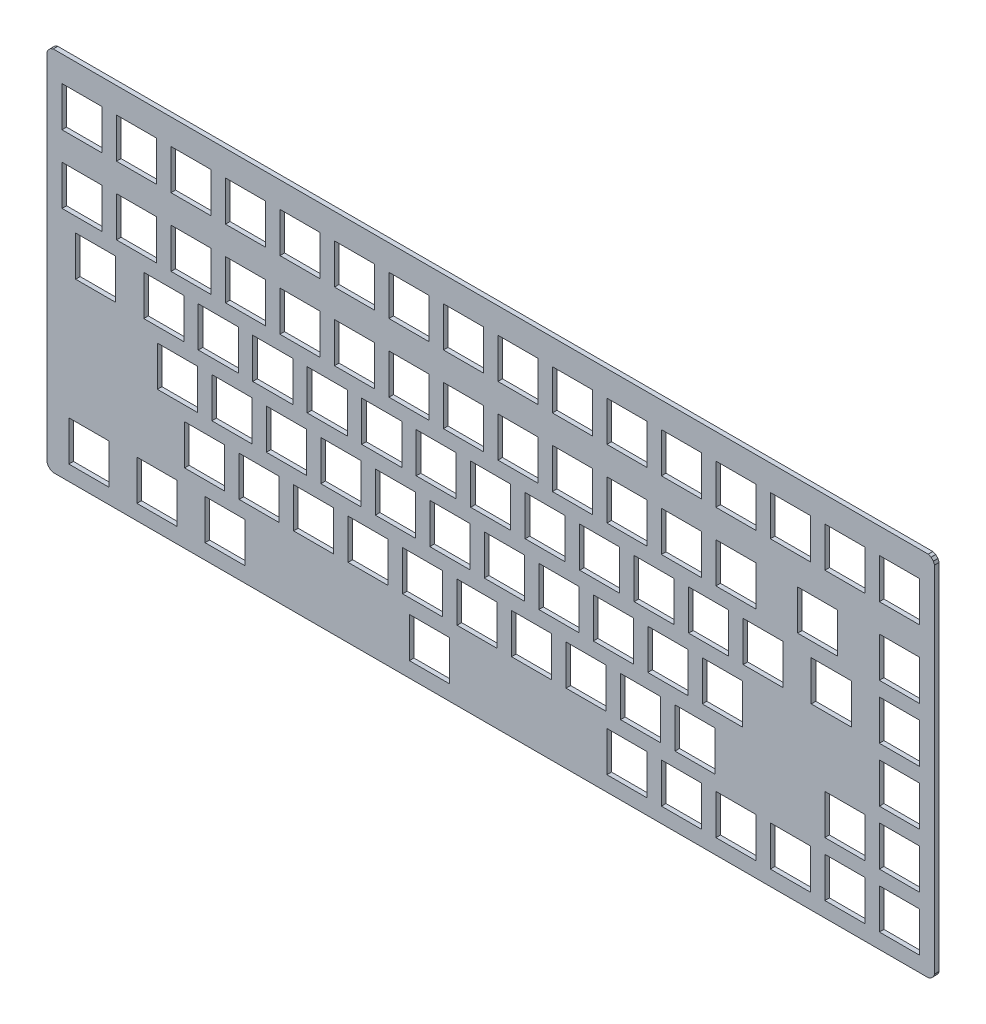
from build123d import *

# Parameters (mm, degrees)
BOSS_EXTRUDE1_DEPTH  = 1.6
SKETCH17_W           = 14
SKETCH17_H           = 14
CUT_EXTRUDE1_DEPTH   = 401.190052506
LPATTERN1_COUNT      = 16
LPATTERN1_PITCH      = 19.05
SKETCH18_W           = 14
SKETCH18_H           = 14
CUT_EXTRUDE2_DEPTH   = 401.190052506
LPATTERN2_COUNT      = 13
LPATTERN2_PITCH      = 19.05
LPATTERN3_COUNT      = 2
LPATTERN3_PITCH      = 257.175
SKETCH20_W           = 14
SKETCH20_H           = 14
CUT_EXTRUDE3_DEPTH   = 401.190052506
SKETCH22_W           = 14
SKETCH22_H           = 14
CUT_EXTRUDE4_DEPTH   = 401.190052506
LPATTERN4_COUNT      = 12
LPATTERN4_PITCH      = 19.05
SKETCH23_W           = 14
SKETCH23_H           = 14
CUT_EXTRUDE5_DEPTH   = 401.190052506
LPATTERN5_COUNT      = 11
LPATTERN5_PITCH      = 19.05
SKETCH24_W           = 14
SKETCH24_H           = 14
CUT_EXTRUDE6_DEPTH   = 401.190052506
LPATTERN6_COUNT      = 10
LPATTERN6_PITCH      = 19.05
SKETCH25_W           = 14
SKETCH25_H           = 14
CUT_EXTRUDE7_DEPTH   = 401.190052506
LPATTERN7_COUNT      = 3
LPATTERN7_PITCH      = 23.8125
SKETCH26_W           = 14
SKETCH26_H           = 14
CUT_EXTRUDE8_DEPTH   = 401.190052506
LPATTERN8_COUNT      = 2
LPATTERN8_PITCH      = 19.05
LPATTERN8_COUNT_DIR2 = 2
LPATTERN8_PITCH_DIR2 = 19.05
SKETCH27_W           = 14
SKETCH27_H           = 14
CUT_EXTRUDE9_DEPTH   = 401.190052506
LPATTERN9_COUNT      = 3
LPATTERN9_PITCH      = 19.05
SKETCH28_W           = 14
SKETCH28_H           = 14
CUT_EXTRUDE10_DEPTH  = 401.190052506
LPATTERN10_COUNT     = 4
LPATTERN10_PITCH     = 19.05
SKETCH29_W           = 14
SKETCH29_H           = 14
CUT_EXTRUDE11_DEPTH  = 401.190052506
LPATTERN11_COUNT     = 2
LPATTERN11_PITCH     = 257.175


with BuildPart() as part:
    # Sketch14 → Boss-Extrude1 (new body)
    with BuildSketch(Plane.XY):
        Polygon((45.775, -56.546653), (45.778843, -56.507635), (45.790224, -56.470116), (46.170826, -55.551262), (46.189308, -55.516684), (46.214181, -55.486377), (46.961377, -54.73918), (46.991684, -54.714308), (47.026261, -54.695826), (47.945116, -54.315224), (47.982635, -54.303843), (48.021653, -54.3), (353.878347, -54.3), (353.917365, -54.303843), (353.954884, -54.315224), (354.873738, -54.695826), (354.908316, -54.714308), (354.938623, -54.739181), (355.68582, -55.486377), (355.710692, -55.516684), (355.729174, -55.551261), (356.109776, -56.470116), (356.121157, -56.507635), (356.125, -56.546653), (356.125, -180.303347), (356.121157, -180.342365), (356.109776, -180.379884), (355.729174, -181.298739), (355.710692, -181.333316), (355.68582, -181.363623), (354.938623, -182.110819), (354.908316, -182.135692), (354.873738, -182.154174), (353.954884, -182.534776), (353.917365, -182.546157), (353.878347, -182.55), (48.021653, -182.55), (47.982635, -182.546157), (47.945116, -182.534776), (47.026261, -182.154174), (46.991684, -182.135692), (46.961377, -182.11082), (46.214181, -181.363623), (46.189308, -181.333316), (46.170826, -181.298738), (45.790224, -180.379884), (45.778843, -180.342365), (45.775, -180.303347), align=None)
    extrude(amount=BOSS_EXTRUDE1_DEPTH)

    # Sketch17 → Cut-Extrude1 (cut, through all)
    with BuildSketch(Plane.XY.offset(1.6)):
        with Locations((58.072891709, -70.2375)):
            Rectangle(SKETCH17_W, SKETCH17_H)
    cut_extrude1 = extrude(amount=-CUT_EXTRUDE1_DEPTH, mode=Mode.SUBTRACT)

    # LPattern1: Cut-Extrude1 ×16
    with Locations(*[(i * LPATTERN1_PITCH, 0, 0) for i in range(1, LPATTERN1_COUNT)]):
        add(cut_extrude1, mode=Mode.SUBTRACT)

    # Sketch18 → Cut-Extrude2 (cut, through all)
    with BuildSketch(Plane.XY.offset(1.6)):
        with Locations((58.073441718, -94.051507519)):
            Rectangle(SKETCH18_W, SKETCH18_H)
    cut_extrude2 = extrude(amount=-CUT_EXTRUDE2_DEPTH, mode=Mode.SUBTRACT)

    # LPattern2: Cut-Extrude2 ×13
    with Locations(*[(i * LPATTERN2_PITCH, 0, 0) for i in range(1, LPATTERN2_COUNT)]):
        add(cut_extrude2, mode=Mode.SUBTRACT)

    # LPattern3: Cut-Extrude2 ×2
    with Locations(*[(i * LPATTERN3_PITCH, 0, 0) for i in range(1, LPATTERN3_COUNT)]):
        add(cut_extrude2, mode=Mode.SUBTRACT)

    # Sketch20 → Cut-Extrude3 (cut, through all)
    with BuildSketch(Plane.XY.offset(1.6)):
        with Locations((62.831674868, -113.106226091)):
            Rectangle(SKETCH20_W, SKETCH20_H)
    cut_extrude3 = extrude(amount=-CUT_EXTRUDE3_DEPTH, mode=Mode.SUBTRACT)

    # Sketch22 → Cut-Extrude4 (cut, through all)
    with BuildSketch(Plane.XY.offset(1.6)):
        with Locations((86.65, -113.1)):
            Rectangle(SKETCH22_W, SKETCH22_H)
    cut_extrude4 = extrude(amount=-CUT_EXTRUDE4_DEPTH, mode=Mode.SUBTRACT)

    # LPattern4: Cut-Extrude4 ×12
    with Locations(*[(i * LPATTERN4_PITCH, 0, 0) for i in range(1, LPATTERN4_COUNT)]):
        add(cut_extrude4, mode=Mode.SUBTRACT)

    # Sketch23 → Cut-Extrude5 (cut, through all)
    with BuildSketch(Plane.XY.offset(1.6)):
        with Locations((91.4125, -132.15)):
            Rectangle(SKETCH23_W, SKETCH23_H)
    cut_extrude5 = extrude(amount=-CUT_EXTRUDE5_DEPTH, mode=Mode.SUBTRACT)

    # LPattern5: Cut-Extrude5 ×11
    with Locations(*[(i * LPATTERN5_PITCH, 0, 0) for i in range(1, LPATTERN5_COUNT)]):
        add(cut_extrude5, mode=Mode.SUBTRACT)

    # Sketch24 → Cut-Extrude6 (cut, through all)
    with BuildSketch(Plane.XY.offset(1.6)):
        with Locations((100.9375, -151.2)):
            Rectangle(SKETCH24_W, SKETCH24_H)
    cut_extrude6 = extrude(amount=-CUT_EXTRUDE6_DEPTH, mode=Mode.SUBTRACT)

    # LPattern6: Cut-Extrude6 ×10
    with Locations(*[(i * LPATTERN6_PITCH, 0, 0) for i in range(1, LPATTERN6_COUNT)]):
        add(cut_extrude6, mode=Mode.SUBTRACT)

    # Sketch25 → Cut-Extrude7 (cut, through all)
    with BuildSketch(Plane.XY.offset(1.6)):
        with Locations((60.45625, -170.25)):
            Rectangle(SKETCH25_W, SKETCH25_H)
    cut_extrude7 = extrude(amount=-CUT_EXTRUDE7_DEPTH, mode=Mode.SUBTRACT)

    # LPattern7: Cut-Extrude7 ×3
    with Locations(*[(i * LPATTERN7_PITCH, 0, 0) for i in range(1, LPATTERN7_COUNT)]):
        add(cut_extrude7, mode=Mode.SUBTRACT)

    # Sketch26 → Cut-Extrude8 (cut, through all)
    with BuildSketch(Plane.XY.offset(1.6)):
        with Locations((324.775, -151.2)):
            Rectangle(SKETCH26_W, SKETCH26_H)
    cut_extrude8 = extrude(amount=-CUT_EXTRUDE8_DEPTH, mode=Mode.SUBTRACT)

    # LPattern8: Cut-Extrude8 2 × 2
    with Locations(*[(i * LPATTERN8_PITCH, -j * LPATTERN8_PITCH_DIR2, 0) for i in range(LPATTERN8_COUNT) for j in range(LPATTERN8_COUNT_DIR2) if (i, j) != (0, 0)]):
        add(cut_extrude8, mode=Mode.SUBTRACT)

    # Sketch27 → Cut-Extrude9 (cut, through all)
    with BuildSketch(Plane.XY.offset(1.6)):
        with Locations((343.825, -94.05)):
            Rectangle(SKETCH27_W, SKETCH27_H)
    cut_extrude9 = extrude(amount=-CUT_EXTRUDE9_DEPTH, mode=Mode.SUBTRACT)

    # LPattern9: Cut-Extrude9 ×3
    with Locations(*[(0, -i * LPATTERN9_PITCH, 0) for i in range(1, LPATTERN9_COUNT)]):
        add(cut_extrude9, mode=Mode.SUBTRACT)

    # Sketch28 → Cut-Extrude10 (cut, through all)
    with BuildSketch(Plane.XY.offset(1.6)):
        with Locations((248.575, -170.25)):
            Rectangle(SKETCH28_W, SKETCH28_H)
    cut_extrude10 = extrude(amount=-CUT_EXTRUDE10_DEPTH, mode=Mode.SUBTRACT)

    # LPattern10: Cut-Extrude10 ×4
    with Locations(*[(i * LPATTERN10_PITCH, 0, 0) for i in range(1, LPATTERN10_COUNT)]):
        add(cut_extrude10, mode=Mode.SUBTRACT)

    # Sketch29 → Cut-Extrude11 (cut, through all)
    with BuildSketch(Plane.XY.offset(1.6)):
        with Locations((179.51875, -170.25)):
            Rectangle(SKETCH29_W, SKETCH29_H)
    extrude(amount=-CUT_EXTRUDE11_DEPTH, mode=Mode.SUBTRACT)

    # LPattern11: Cut-Extrude3 ×2
    with Locations(*[(i * LPATTERN11_PITCH, 0, 0) for i in range(1, LPATTERN11_COUNT)]):
        add(cut_extrude3, mode=Mode.SUBTRACT)


solid = part.part
